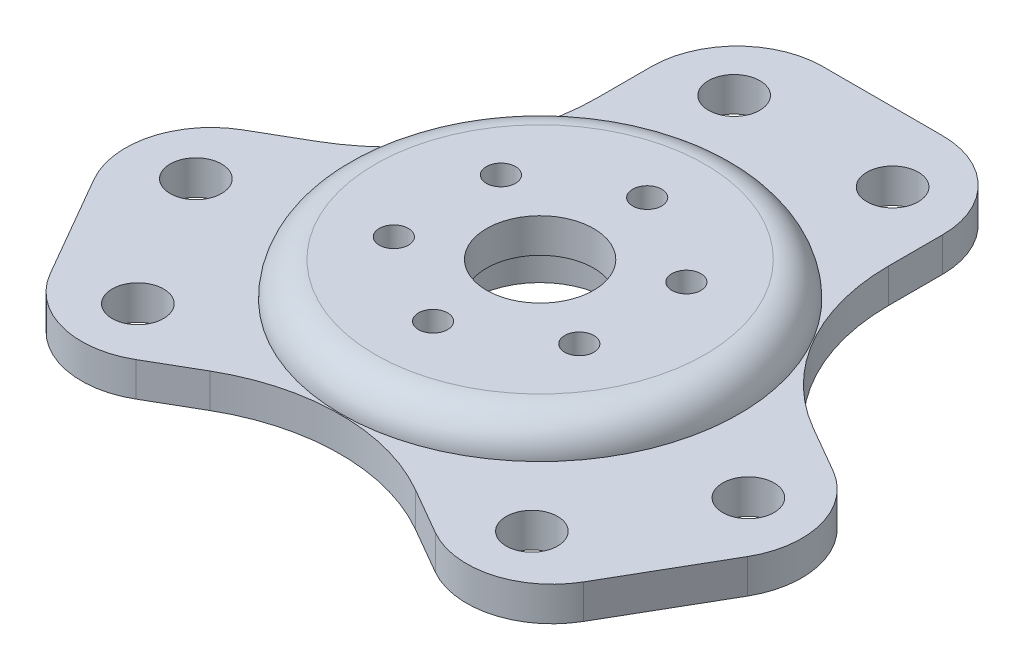
from build123d import *

# Parameters (mm, degrees)
SKETCH_1_R               = 6.25
EXTRUDE_627_DEPTH        = 8
SKETCH_2_R               = 8
CUT_EXTRUDE_911_DEPTH    = 4
SKETCH_3_R               = 1.7
CUT_EXTRUDE_3_DEPTH      = 60.372950698
PATTERN_CIRCULAR_1_COUNT = 6
SKETCH_4_R               = 47.5
SKETCH_4_R_2             = 23.25
CUT_EXTRUDE_3_2_DEPTH    = 4
FILLET_1_R               = 10
FILLET_2_R               = 24
FILLET_3_R               = 4
SKETCH_5_R               = 3
CUT_EXTRUDE_2981_DEPTH   = 57.344747555
PATTERN_CIRCULAR_2_COUNT = 3


# Some blends are built 0.0001 mm under size
with BuildPart() as part:
    # Эскиз1 → Extrude 627 (new body)
    with BuildSketch(Plane(origin=(0, 0, 0), x_dir=(1, 0, 0), z_dir=(0, 1, 0))):
        Polygon((-17, 9.814954576), (-17, 40), (17, 40), (17, 9.814954576), (43.141016151, -5.277568136), (26.141016151, -34.722431864), (0, -19.629909152), (-26.141016151, -34.722431864), (-43.141016151, -5.277568136), align=None)
        with Locations(Location((0, 0, 0), (0, 0, 270))):
            Circle(SKETCH_1_R, mode=Mode.SUBTRACT)
    extrude(amount=EXTRUDE_627_DEPTH)

    # Эскиз2 → Cut-Extrude 911 (cut)
    with BuildSketch(Plane(origin=(0, 0, 0), x_dir=(1, 0, 0), z_dir=(0, 1, 0))):
        with Locations(Location((0, 0, 0), (0, 0, 270))):
            Circle(SKETCH_2_R)
    extrude(amount=CUT_EXTRUDE_911_DEPTH, mode=Mode.SUBTRACT)

    # Эскиз3 → Cut-Extrude 3 (cut, through all)
    with BuildSketch(Plane(origin=(0, 8, 0), x_dir=(1, 0, 0), z_dir=(0, 1, 0))):
        with Locations(Location((0, 12.5, 0), (0, 0, 270))):
            Circle(SKETCH_3_R)
    cut_extrude_3 = extrude(amount=-CUT_EXTRUDE_3_DEPTH, mode=Mode.SUBTRACT)

    # Круговой массив1: Cut-Extrude 3 ×6 about axis
    pattern_circular_1_axis = Axis((0, 0, 0), (0, 1, 0))
    for i in range(1, PATTERN_CIRCULAR_1_COUNT):
        add(cut_extrude_3.rotate(pattern_circular_1_axis, i * 360 / PATTERN_CIRCULAR_1_COUNT), mode=Mode.SUBTRACT)

    # Эскиз4 → Cut-Extrude 3 2 (cut)
    with BuildSketch(Plane.XZ.offset(-8)):
        Circle(SKETCH_4_R)
        Circle(SKETCH_4_R_2, mode=Mode.SUBTRACT)
    extrude(amount=CUT_EXTRUDE_3_2_DEPTH, mode=Mode.SUBTRACT)

    # Скругление1
    fillet_1_edges = [part.edges().sort_by_distance(p)[0] for p in [
        (-17, 2, -40),
        (17, 2, -40),
        (43.141016151, 2, 5.277568136),
        (26.141016151, 2, 34.722431864),
        (-26.141016151, 2, 34.722431864),
        (-43.141016151, 2, 5.277568136),
    ]]
    fillet(fillet_1_edges, radius=FILLET_1_R)

    # Скругление2
    # the kernel refuses this fillet: 24 mm, written as the material it adds along each edge
    with BuildSketch(Plane(origin=(17, 0, -9.814954576), x_dir=(0, 0, -1), z_dir=(0, 1, 0))) as fillet_2_piece_1_section:
        with BuildLine():
            CenterArc((FILLET_2_R * 0.57735026919, -FILLET_2_R), FILLET_2_R, 90, 60)
            Line((-FILLET_2_R * 0.288675134595, -FILLET_2_R * 0.5), (0, 0))
            Line((0, 0), (FILLET_2_R * 0.57735026919, 0))
        make_face()
    fillet_2_piece_1 = extrude(amount=8, mode=Mode.PRIVATE)
    fillet_2_piece_1 = split(fillet_2_piece_1, bisect_by=Plane(origin=(20.179222724, 4, -11.650479672), z_dir=(0, -1, 0)), keep=Keep.TOP, mode=Mode.PRIVATE)
    fillet_2_piece_1 = fillet_2_piece_1 - Plane(origin=(0, 2, 0), x_dir=(1, 0, 0), z_dir=(0, 1, 0)) * Cylinder(23.25, 72, mode=Mode.PRIVATE)
    add(fillet_2_piece_1)
    with BuildSketch(Plane(origin=(17, 0, -9.814954576), x_dir=(0, 0, -1), z_dir=(0, 1, 0))) as fillet_2_piece_2_section:
        with BuildLine():
            CenterArc((FILLET_2_R * 0.57735026919, -FILLET_2_R), FILLET_2_R, 90, 60)
            Line((-FILLET_2_R * 0.288675134595, -FILLET_2_R * 0.5), (0, 0))
            Line((0, 0), (FILLET_2_R * 0.57735026919, 0))
        make_face()
    fillet_2_piece_2 = extrude(amount=8, mode=Mode.PRIVATE)
    fillet_2_piece_2 = split(fillet_2_piece_2, bisect_by=Plane(origin=(18.777250195, 4, -10.841050455), z_dir=(0, -1, 0)), keep=Keep.TOP, mode=Mode.PRIVATE)
    fillet_2_piece_2 = fillet_2_piece_2 & Plane(origin=(0, 2, 0), x_dir=(1, 0, 0), z_dir=(0, 1, 0)) * Cylinder(23.25, 72, mode=Mode.PRIVATE)
    add(fillet_2_piece_2)
    with BuildSketch(Plane(origin=(17, 0, -9.814954576), x_dir=(0, 0, -1), z_dir=(0, 1, 0))) as fillet_2_piece_3_section:
        with BuildLine():
            CenterArc((FILLET_2_R * 0.57735026919, -FILLET_2_R), FILLET_2_R, 90, 60)
            Line((-FILLET_2_R * 0.288675134595, -FILLET_2_R * 0.5), (0, 0))
            Line((0, 0), (FILLET_2_R * 0.57735026919, 0))
        make_face()
    fillet_2_piece_3 = extrude(amount=8, mode=Mode.PRIVATE)
    fillet_2_piece_3 = split(fillet_2_piece_3, bisect_by=Plane(origin=(18.777250195, 4, -10.841050455), z_dir=(0, 1, 0)), keep=Keep.TOP, mode=Mode.PRIVATE)
    fillet_2_piece_3 = fillet_2_piece_3 & Plane(origin=(0, 6, 0), x_dir=(1, 0, 0), z_dir=(0, 1, 0)) * Cylinder(23.25, 72, mode=Mode.PRIVATE)
    add(fillet_2_piece_3)
    with BuildSketch(Plane(origin=(-17, 0, -9.814954576), x_dir=(0, 0, -1), z_dir=(0, 1, 0))) as fillet_2_piece_4_section:
        with BuildLine():
            CenterArc((FILLET_2_R * 0.57735026919, FILLET_2_R), FILLET_2_R, 210, 60)
            Line((-FILLET_2_R * 0.288675134595, FILLET_2_R * 0.5), (0, 0))
            Line((0, 0), (FILLET_2_R * 0.57735026919, 0))
        make_face()
    fillet_2_piece_4 = extrude(amount=8, mode=Mode.PRIVATE)
    fillet_2_piece_4 = split(fillet_2_piece_4, bisect_by=Plane(origin=(-20.179222724, 4, -11.650479672), z_dir=(0, -1, 0)), keep=Keep.TOP, mode=Mode.PRIVATE)
    fillet_2_piece_4 = fillet_2_piece_4 - Plane(origin=(0, 2, 0), x_dir=(1, 0, 0), z_dir=(0, 1, 0)) * Cylinder(23.25, 72, mode=Mode.PRIVATE)
    add(fillet_2_piece_4)
    with BuildSketch(Plane(origin=(-17, 0, -9.814954576), x_dir=(0, 0, -1), z_dir=(0, 1, 0))) as fillet_2_piece_5_section:
        with BuildLine():
            CenterArc((FILLET_2_R * 0.57735026919, FILLET_2_R), FILLET_2_R, 210, 60)
            Line((-FILLET_2_R * 0.288675134595, FILLET_2_R * 0.5), (0, 0))
            Line((0, 0), (FILLET_2_R * 0.57735026919, 0))
        make_face()
    fillet_2_piece_5 = extrude(amount=8, mode=Mode.PRIVATE)
    fillet_2_piece_5 = split(fillet_2_piece_5, bisect_by=Plane(origin=(-18.777250195, 4, -10.841050455), z_dir=(0, -1, 0)), keep=Keep.TOP, mode=Mode.PRIVATE)
    fillet_2_piece_5 = fillet_2_piece_5 & Plane(origin=(0, 2, 0), x_dir=(1, 0, 0), z_dir=(0, 1, 0)) * Cylinder(23.25, 72, mode=Mode.PRIVATE)
    add(fillet_2_piece_5)
    with BuildSketch(Plane(origin=(-17, 0, -9.814954576), x_dir=(0, 0, -1), z_dir=(0, 1, 0))) as fillet_2_piece_6_section:
        with BuildLine():
            CenterArc((FILLET_2_R * 0.57735026919, FILLET_2_R), FILLET_2_R, 210, 60)
            Line((-FILLET_2_R * 0.288675134595, FILLET_2_R * 0.5), (0, 0))
            Line((0, 0), (FILLET_2_R * 0.57735026919, 0))
        make_face()
    fillet_2_piece_6 = extrude(amount=8, mode=Mode.PRIVATE)
    fillet_2_piece_6 = split(fillet_2_piece_6, bisect_by=Plane(origin=(-18.777250195, 4, -10.841050455), z_dir=(0, 1, 0)), keep=Keep.TOP, mode=Mode.PRIVATE)
    fillet_2_piece_6 = fillet_2_piece_6 & Plane(origin=(0, 6, 0), x_dir=(1, 0, 0), z_dir=(0, 1, 0)) * Cylinder(23.25, 72, mode=Mode.PRIVATE)
    add(fillet_2_piece_6)
    with BuildSketch(Plane(origin=(0, 0, 19.629909152), x_dir=(-0.8660254037844384, 0, 0.5000000000000003), z_dir=(0, 1, 0))) as fillet_2_piece_7_section:
        with BuildLine():
            CenterArc((FILLET_2_R * 0.57735026919, FILLET_2_R), FILLET_2_R, 210, 60)
            Line((-FILLET_2_R * 0.288675134595, FILLET_2_R * 0.5), (0, 0))
            Line((0, 0), (FILLET_2_R * 0.57735026919, 0))
        make_face()
    fillet_2_piece_7 = extrude(amount=8, mode=Mode.PRIVATE)
    fillet_2_piece_7 = split(fillet_2_piece_7, bisect_by=Plane(origin=(0, 4, 23.300959344), z_dir=(0, -1, 0)), keep=Keep.TOP, mode=Mode.PRIVATE)
    fillet_2_piece_7 = fillet_2_piece_7 - Plane(origin=(0, 2, 0), x_dir=(1, 0, 0), z_dir=(0, 1, 0)) * Cylinder(23.25, 72, mode=Mode.PRIVATE)
    add(fillet_2_piece_7)
    with BuildSketch(Plane(origin=(0, 0, 19.629909152), x_dir=(-0.8660254037844384, 0, 0.5000000000000003), z_dir=(0, 1, 0))) as fillet_2_piece_8_section:
        with BuildLine():
            CenterArc((FILLET_2_R * 0.57735026919, FILLET_2_R), FILLET_2_R, 210, 60)
            Line((-FILLET_2_R * 0.288675134595, FILLET_2_R * 0.5), (0, 0))
            Line((0, 0), (FILLET_2_R * 0.57735026919, 0))
        make_face()
    fillet_2_piece_8 = extrude(amount=8, mode=Mode.PRIVATE)
    fillet_2_piece_8 = split(fillet_2_piece_8, bisect_by=Plane(origin=(0, 4, 21.68210091), z_dir=(0, -1, 0)), keep=Keep.TOP, mode=Mode.PRIVATE)
    fillet_2_piece_8 = fillet_2_piece_8 & Plane(origin=(0, 2, 0), x_dir=(1, 0, 0), z_dir=(0, 1, 0)) * Cylinder(23.25, 72, mode=Mode.PRIVATE)
    add(fillet_2_piece_8)
    with BuildSketch(Plane(origin=(0, 0, 19.629909152), x_dir=(-0.8660254037844384, 0, 0.5000000000000003), z_dir=(0, 1, 0))) as fillet_2_piece_9_section:
        with BuildLine():
            CenterArc((FILLET_2_R * 0.57735026919, FILLET_2_R), FILLET_2_R, 210, 60)
            Line((-FILLET_2_R * 0.288675134595, FILLET_2_R * 0.5), (0, 0))
            Line((0, 0), (FILLET_2_R * 0.57735026919, 0))
        make_face()
    fillet_2_piece_9 = extrude(amount=8, mode=Mode.PRIVATE)
    fillet_2_piece_9 = split(fillet_2_piece_9, bisect_by=Plane(origin=(0, 4, 21.68210091), z_dir=(0, 1, 0)), keep=Keep.TOP, mode=Mode.PRIVATE)
    fillet_2_piece_9 = fillet_2_piece_9 & Plane(origin=(0, 6, 0), x_dir=(1, 0, 0), z_dir=(0, 1, 0)) * Cylinder(23.25, 72, mode=Mode.PRIVATE)
    add(fillet_2_piece_9)

    # Скругление3
    fillet_3_edges = [part.edges().sort_by_distance(p)[0] for p in [
        (-5.23578811, 8, -22.652792827),
    ]]
    fillet(fillet_3_edges, radius=FILLET_3_R - 0.0001)  # a hair under: the kernel refuses the full size

    # Эскиз5 → Cut-Extrude 2981 (cut, through all)
    with BuildSketch(Plane(origin=(0, 4, 0), x_dir=(-1, 0, 0), z_dir=(0, 1, 0))):
        with Locations(Location((-9.25, -31.898395826, 0), (0, 0, 90))):
            Circle(SKETCH_5_R)
        with Locations(Location((-32.249821125, 7.938462928, 0), (0, 0, 90))):
            Circle(SKETCH_5_R)
    cut_extrude_2981 = extrude(amount=-CUT_EXTRUDE_2981_DEPTH, mode=Mode.SUBTRACT)

    # Круговой массив2: Cut-Extrude 2981 ×3 about axis
    pattern_circular_2_axis = Axis((0, 0, 0), (0, 1, 0))
    for i in range(1, PATTERN_CIRCULAR_2_COUNT):
        add(cut_extrude_2981.rotate(pattern_circular_2_axis, i * 360 / PATTERN_CIRCULAR_2_COUNT), mode=Mode.SUBTRACT)


solid = part.part
